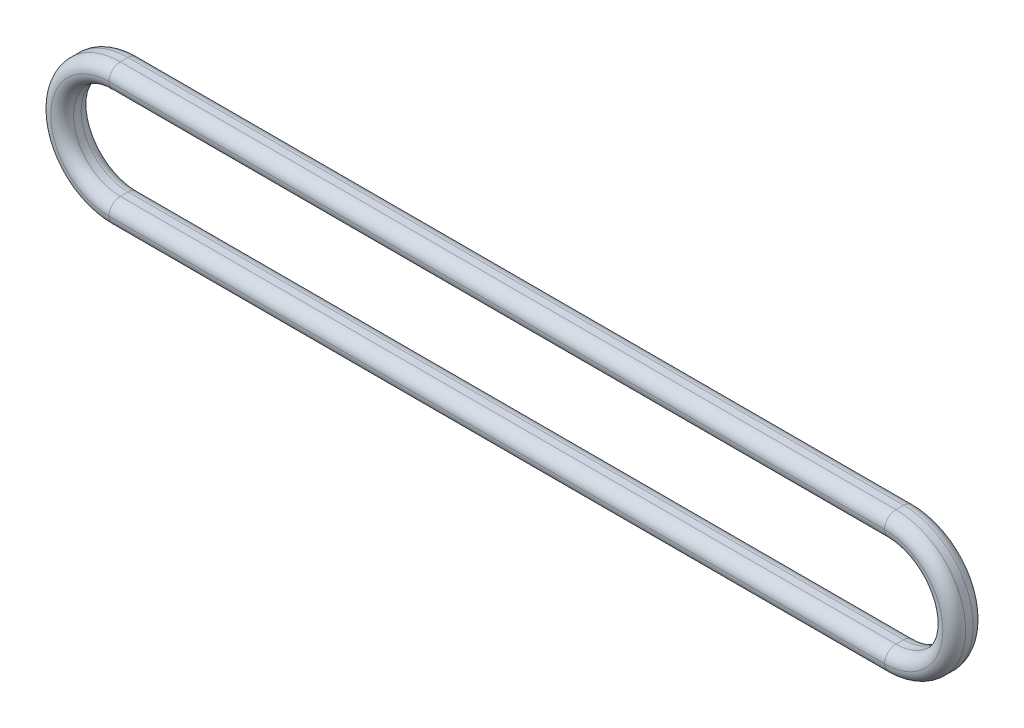
from build123d import *

# Parameters (mm, degrees)
BOSS_EXTRUDE1_DEPTH = 14.224
FILLET1_R           = 5.334


with BuildPart() as part:
    # Sketch1 → Boss-Extrude1 (new body)
    with BuildSketch(Plane.XY):
        with BuildLine():
            Line((-361.95, 32.512), (0, 32.512))
            ThreePointArc((0, 32.512), (32.512, 0), (0, -32.512))
            Line((0, -32.512), (-361.95, -32.512))
            ThreePointArc((-361.95, -32.512), (-394.462, 0), (-361.95, 32.512))
        make_face()
        with BuildLine():
            Line((0, -21.844), (-361.95, -21.844))
            ThreePointArc((-361.95, -21.844), (-383.794, 0), (-361.95, 21.844))
            Line((-361.95, 21.844), (0, 21.844))
            ThreePointArc((0, 21.844), (21.844, 0), (0, -21.844))
        make_face(mode=Mode.SUBTRACT)
    extrude(amount=BOSS_EXTRUDE1_DEPTH)

    # Fillet1
    fillet1_edges = [part.edges().sort_by_distance(p)[0] for p in [
        (32.512, 0, 14.224),
        (-180.975, 32.512, 14.224),
        (21.844, 0, 0),
        (-180.975, 21.844, 0),
        (-383.794, 0, 0),
        (-180.975, -21.844, 0),
        (21.844, 0, 14.224),
        (-180.975, 21.844, 14.224),
        (-383.794, 0, 14.224),
        (-180.975, -21.844, 14.224),
        (-394.462, 0, 14.224),
        (-180.975, 32.512, 0),
        (32.512, 0, 0),
        (-180.975, -32.512, 0),
        (-394.462, 0, 0),
        (-180.975, -32.512, 14.224),
    ]]
    fillet(fillet1_edges, radius=FILLET1_R - 0.0001)  # a hair under: the kernel refuses the full size


solid = part.part
